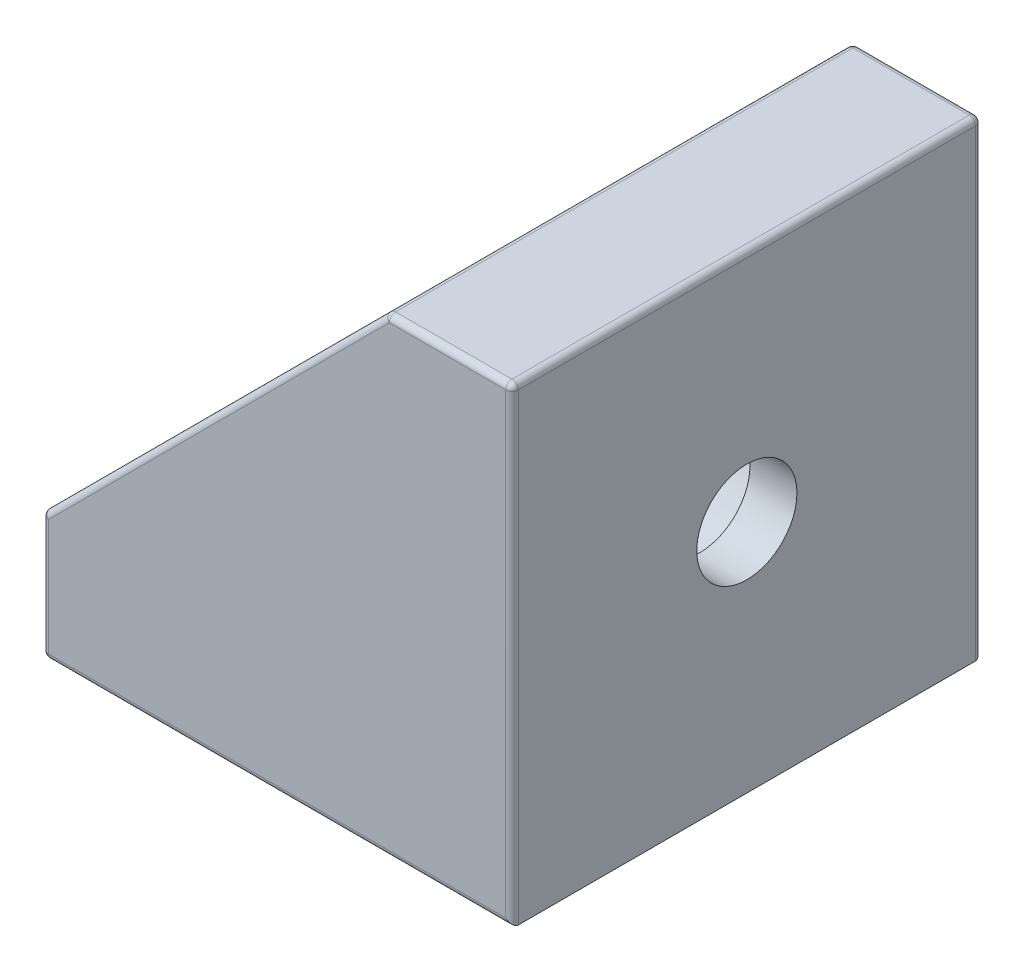
from build123d import *

# Parameters (mm, degrees)
BOSS_EXTRUDE1_DEPTH = 30
SKETCH3_R           = 3.2
CUT_EXTRUDE8_DEPTH  = 33
SKETCH5_R           = 3.2
CUT_EXTRUDE5_DEPTH  = 32
CUT_EXTRUDE9_START  = -27
SKETCH8_R           = 6
SKETCH8_R_2         = 3.2
CUT_EXTRUDE9_DEPTH  = 27
CUT_EXTRUDE10_START = -27
SKETCH7_R           = 6
SKETCH7_R_2         = 3.2
CUT_EXTRUDE10_DEPTH = 27
FILLET6_R           = 0.4


with BuildPart() as part:
    # Sketch2 → Boss-Extrude1 (new body)
    with BuildSketch(Plane.XY):
        Polygon((0, 0), (30, 0), (30, 30), (22, 30), (0, 8), align=None)
    extrude(amount=BOSS_EXTRUDE1_DEPTH)

    # Sketch3 → Cut-Extrude8 (cut)
    with BuildSketch(Plane(origin=(30, 0, 0), x_dir=(0, 0, -1), z_dir=(1, 0, 0))):
        with Locations((-15, 15)):
            Circle(SKETCH3_R)
    extrude(amount=-CUT_EXTRUDE8_DEPTH, mode=Mode.SUBTRACT)

    # Sketch5 → Cut-Extrude5 (cut)
    with BuildSketch(Plane.XZ):
        with Locations((15, 15)):
            Circle(SKETCH5_R)
    extrude(amount=-CUT_EXTRUDE5_DEPTH, mode=Mode.SUBTRACT)

    # Sketch8 → Cut-Extrude9 (cut)
    with BuildSketch(Plane.ZY.offset(CUT_EXTRUDE9_START)):
        with Locations((15, 15)):
            Circle(SKETCH8_R)
        with Locations((15, 15)):
            Circle(SKETCH8_R_2, mode=Mode.SUBTRACT)
    extrude(amount=CUT_EXTRUDE9_DEPTH, mode=Mode.SUBTRACT)

    # Sketch7 → Cut-Extrude10 (cut)
    with BuildSketch(Plane(origin=(0, 30, 0), x_dir=(1, 0, 0), z_dir=(0, 1, 0)).offset(CUT_EXTRUDE10_START)):
        with Locations((15, -15)):
            Circle(SKETCH7_R)
        with Locations((15, -15)):
            Circle(SKETCH7_R_2, mode=Mode.SUBTRACT)
    extrude(amount=CUT_EXTRUDE10_DEPTH, mode=Mode.SUBTRACT)

    # Fillet6
    fillet6_edges = [part.edges().sort_by_distance(p)[0] for p in [
        (30, 30, 15),
        (26, 30, 30),
        (30, 15, 30),
        (15, 0, 30),
        (0, 4, 30),
        (0, 0, 15),
        (15, 0, 0),
        (30, 15, 0),
        (26, 30, 0),
        (0, 4, 0),
        (22, 30, 15),
        (11, 19, 30),
        (0, 8, 15),
        (11, 19, 0),
        (1.671913993, 9.671913993, 12.241105383),
        (16.935572078, 24.935572078, 9.320778158),
    ]]
    fillet(fillet6_edges, radius=FILLET6_R)


solid = part.part
